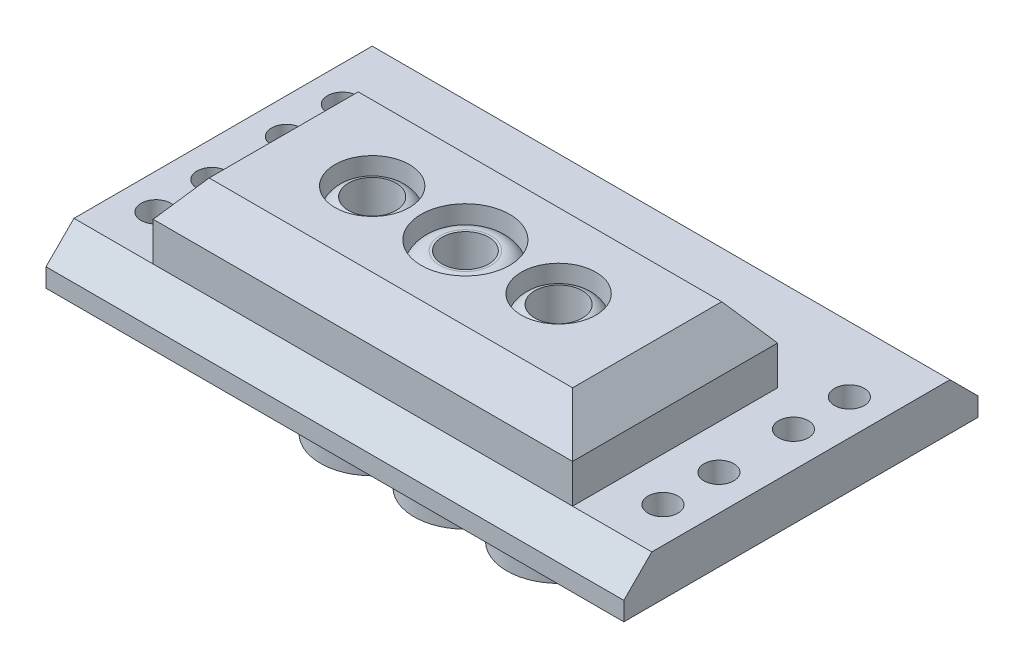
from build123d import *

# Parameters (mm, degrees)
CROQUIS1_W              = 62
CROQUIS1_H              = 38
CROQUIS1_R              = 1.6
CROQUIS1_R_2            = 2.5
CROQUIS1_R_3            = 2.55
SALIENTE_EXTRUIR1_DEPTH = 5
CROQUIS2_R              = 4.75
CROQUIS2_R_2            = 2.5
SALIENTE_EXTRUIR2_DEPTH = 7
REDONDEO2_R             = 2
CROQUIS4_R              = 4
CROQUIS4_R_2            = 2.55
SALIENTE_EXTRUIR3_DEPTH = 7
REDONDEO3_R             = 2
CHAFL_N1_SIZE           = 3
CROQUIS5_W              = 45
CROQUIS5_H              = 22
CROQUIS5_R              = 4
CROQUIS5_R_2            = 4.75
SALIENTE_EXTRUIR4_DEPTH = 8
SALIENTE_EXTRUIR7_START = 10
CROQUIS9_R              = 2.55
CROQUIS9_R_2            = 2.5
SALIENTE_EXTRUIR7_DEPTH = 10
CHAFL_N2_SIZE           = 3
CHAFL_N2_SIZE2          = 3.839824897


with BuildPart() as part:
    # Croquis1 → Saliente-Extruir1 (new body)
    with BuildSketch(Plane(origin=(0, 0, 0), x_dir=(1, 0, 0), z_dir=(0, 1, 0))):
        Rectangle(CROQUIS1_W, CROQUIS1_H)
        with Locations(Location((27.2, -11, 0), (0, 0, 270))):
            Circle(CROQUIS1_R, mode=Mode.SUBTRACT)
        with Locations(Location((27.2, -5, 0), (0, 0, 270))):
            Circle(CROQUIS1_R, mode=Mode.SUBTRACT)
        with Locations(Location((-27.2, -11, 0), (0, 0, 270))):
            Circle(CROQUIS1_R, mode=Mode.SUBTRACT)
        with Locations(Location((-27.2, -5, 0), (0, 0, 270))):
            Circle(CROQUIS1_R, mode=Mode.SUBTRACT)
        with Locations(Location((27.2, 9, 0), (0, 0, 270))):
            Circle(CROQUIS1_R, mode=Mode.SUBTRACT)
        with Locations(Location((27.2, 3, 0), (0, 0, 270))):
            Circle(CROQUIS1_R, mode=Mode.SUBTRACT)
        with Locations(Location((-27.2, 3, 0), (0, 0, 270))):
            Circle(CROQUIS1_R, mode=Mode.SUBTRACT)
        with Locations(Location((-27.2, 9, 0), (0, 0, 270))):
            Circle(CROQUIS1_R, mode=Mode.SUBTRACT)
        with Locations(Location((0, -5, 0), (0, 0, 270))):
            Circle(CROQUIS1_R_2, mode=Mode.SUBTRACT)
        with Locations(Location((10, -5, 0), (0, 0, 270))):
            Circle(CROQUIS1_R_3, mode=Mode.SUBTRACT)
        with Locations(Location((-10, -5, 0), (0, 0, 270))):
            Circle(CROQUIS1_R_3, mode=Mode.SUBTRACT)
    extrude(amount=SALIENTE_EXTRUIR1_DEPTH)

    # Croquis2 → Saliente-Extruir2 (add)
    with BuildSketch(Plane(origin=(0, 5, 0), x_dir=(1, 0, 0), z_dir=(0, 1, 0))):
        with Locations(Location((0, -5, 0), (0, 0, 90))):
            Circle(CROQUIS2_R)
        with Locations(Location((0, -5, 0), (0, 0, 270))):
            Circle(CROQUIS2_R_2, mode=Mode.SUBTRACT)
    extrude(amount=SALIENTE_EXTRUIR2_DEPTH)

    # Redondeo2
    redondeo2_edges = [part.edges().sort_by_distance(p)[0] for p in [
        (0, 12, 9.75),
    ]]
    fillet(redondeo2_edges, radius=REDONDEO2_R)

    # Croquis4 → Saliente-Extruir3 (add)
    # profile 1 of 2: a face of its own
    with BuildSketch(Plane(origin=(0, 5, 0), x_dir=(1, 0, 0), z_dir=(0, 1, 0))):
        with Locations(Location((-10, -5, 0), (0, 0, 90))):
            Circle(CROQUIS4_R)
        with Locations(Location((-10, -5, 0), (0, 0, 270))):
            Circle(CROQUIS4_R_2, mode=Mode.SUBTRACT)
    # profile 2 of 2: a face of its own
    with BuildSketch(Plane(origin=(0, 5, 0), x_dir=(1, 0, 0), z_dir=(0, 1, 0))):
        with Locations(Location((10, -5, 0), (0, 0, 90))):
            Circle(CROQUIS4_R)
        with Locations(Location((10, -5, 0), (0, 0, 270))):
            Circle(CROQUIS4_R_2, mode=Mode.SUBTRACT)
    extrude(amount=SALIENTE_EXTRUIR3_DEPTH)

    # Redondeo3
    # the kernel refuses this fillet: 2 mm, written as the material it takes off along each edge
    with BuildSketch(Plane(origin=(-10, 12, 5), x_dir=(0, 0, -1), z_dir=(1, 0, 0))) as redondeo3_piece_1:
        with BuildLine():
            CenterArc((2, -1.922888452), REDONDEO3_R, 0, 74.037985837)
            Line((4, -1.922888452), (4.04, -1.922888452))
            Line((4.04, -1.922888452), (4.04, 0))
            Line((4.04, 0), (4, 0.04))
            ThreePointArc((4, 0.04), (3.275, 0.04), (2.561, 0.038457769))
            Line((2.561, 0.038457769), (2.55, 0))
        make_face()
    revolve(axis=Axis((-10, 12, 5), (0, 1, 0)), mode=Mode.SUBTRACT)
    with BuildSketch(Plane(origin=(10, 12, 5), x_dir=(0, 0, -1), z_dir=(1, 0, 0))) as redondeo3_piece_2:
        with BuildLine():
            CenterArc((2, -1.922888452), REDONDEO3_R, 0, 74.037985837)
            Line((4, -1.922888452), (4.04, -1.922888452))
            Line((4.04, -1.922888452), (4.04, 0))
            Line((4.04, 0), (4, 0.04))
            ThreePointArc((4, 0.04), (3.275, 0.04), (2.561, 0.038457769))
            Line((2.561, 0.038457769), (2.55, 0))
        make_face()
    revolve(axis=Axis((10, 12, 5), (0, 1, 0)), mode=Mode.SUBTRACT)

    # Chaflán1
    chafl_n1_edges = [part.edges().sort_by_distance(p)[0] for p in [
        (0, 5, 19),
        (0, 5, -19),
    ]]
    chamfer(chafl_n1_edges, length=CHAFL_N1_SIZE)

    # Croquis9 → Saliente-Extruir7 (add)
    with BuildSketch(Plane.XZ.offset(SALIENTE_EXTRUIR7_START)):
        with BuildLine():
            ThreePointArc((4.972375, 2.649364584), (15.55, 5), (4.972375, 7.350635416))
            ThreePointArc((4.972375, 7.350635416), (0, 10.5), (-4.972375, 7.350635416))
            ThreePointArc((-4.972375, 7.350635416), (-15.55, 5), (-4.972375, 2.649364584))
            ThreePointArc((-4.972375, 2.649364584), (0, -0.5), (4.972375, 2.649364584))
        make_face()
        with Locations(Location((10, 5, 0), (0, 0, 270))):
            Circle(CROQUIS9_R, mode=Mode.SUBTRACT)
        with Locations(Location((0, 5, 0), (0, 0, 270))):
            Circle(CROQUIS9_R_2, mode=Mode.SUBTRACT)
        with Locations(Location((-10, 5, 0), (0, 0, 270))):
            Circle(CROQUIS9_R, mode=Mode.SUBTRACT)
    extrude(amount=-SALIENTE_EXTRUIR7_DEPTH)


with BuildPart() as body_2:
    # Croquis5 → Saliente-Extruir4 (new body)
    with BuildSketch(Plane(origin=(0, 5, 0), x_dir=(1, 0, 0), z_dir=(0, 1, 0))):
        with Locations((0, -5)):
            Rectangle(CROQUIS5_W, CROQUIS5_H)
        with Locations((10, -5)):
            Circle(CROQUIS5_R, mode=Mode.SUBTRACT)
        with Locations((-10, -5)):
            Circle(CROQUIS5_R, mode=Mode.SUBTRACT)
        with Locations((0, -5)):
            Circle(CROQUIS5_R_2, mode=Mode.SUBTRACT)
    extrude(amount=SALIENTE_EXTRUIR4_DEPTH)

    # Chaflán2
    chafl_n2_edges = [body_2.edges().sort_by_distance(p)[0] for p in [
        (0, 13, -6),
        (-22.5, 13, 5),
        (0, 13, 16),
        (22.5, 13, 5),
    ]]
    chafl_n2_side = [body_2.faces().sort_by_distance(p)[0] for p in [
        (21.999100809, 13, 5),
    ]]
    chamfer(chafl_n2_edges, length=CHAFL_N2_SIZE, length2=CHAFL_N2_SIZE2, reference=chafl_n2_side[0])


solid = Compound([part.part, body_2.part])
